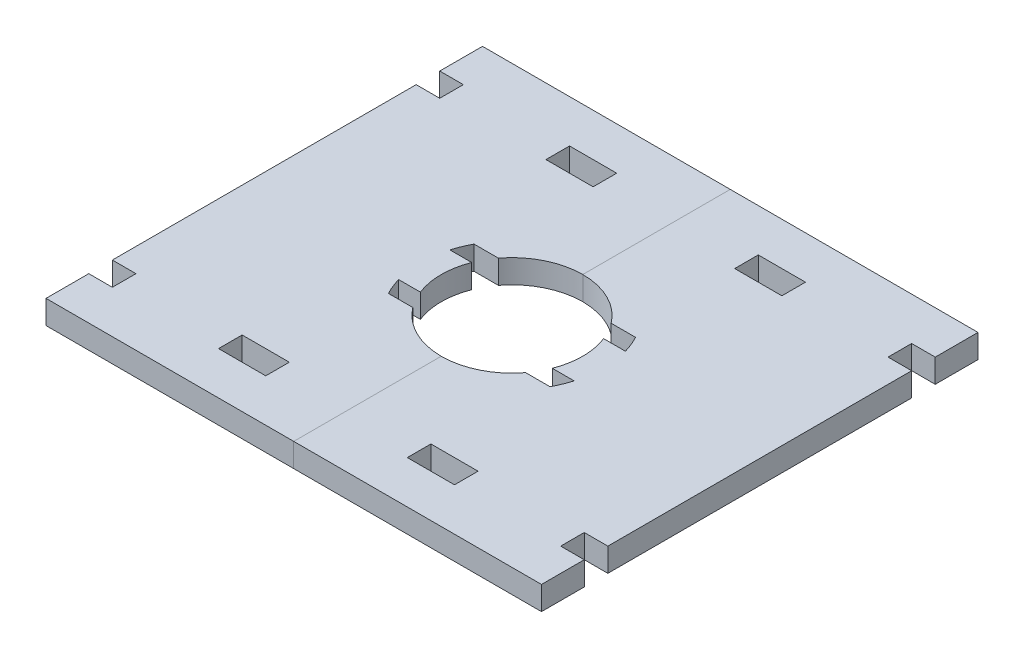
from build123d import *

# Parameters (mm, degrees)
SKETCH2_W               = 84
SKETCH2_H               = 74
BOSS_EXTRUDE1_DEPTH     = 4
CUT_EXTRUDE2_DEPTH      = 57.115951386
CUT_EXTRUDE2_DEPTH_BACK = 57.115951386
SKETCH4_W               = 8
SKETCH4_H               = 4
SKETCH4_W_2             = 4


with BuildPart() as part:
    # Sketch2 → Boss-Extrude1 (new body)
    with BuildSketch(Plane(origin=(0, 0, 0), x_dir=(1, 0, 0), z_dir=(0, 1, 0))):
        Rectangle(SKETCH2_W, SKETCH2_H)
        with BuildLine():
            ThreePointArc((11.183805256, 4.35), (12, 0), (11.183805256, -4.35))
            Line((11.183805256, -4.35), (14.877079687, -4.35))
            ThreePointArc((14.877079687, -4.35), (14.361878956, -5.829788405), (13.699908759, -7.25))
            Line((13.699908759, -7.25), (9.562295749, -7.25))
            ThreePointArc((9.562295749, -7.25), (0, -12), (-9.562295749, -7.25))
            Line((-9.562295749, -7.25), (-13.699908759, -7.25))
            ThreePointArc((-13.699908759, -7.25), (-14.361878956, -5.829788405), (-14.877079687, -4.35))
            Line((-14.877079687, -4.35), (-11.183805256, -4.35))
            ThreePointArc((-11.183805256, -4.35), (-12, 0), (-11.183805256, 4.35))
            Line((-11.183805256, 4.35), (-14.877079687, 4.35))
            ThreePointArc((-14.877079687, 4.35), (-14.361878956, 5.829788405), (-13.699908759, 7.25))
            Line((-13.699908759, 7.25), (-9.562295749, 7.25))
            ThreePointArc((-9.562295749, 7.25), (0, 12), (9.562295749, 7.25))
            Line((9.562295749, 7.25), (13.699908759, 7.25))
            ThreePointArc((13.699908759, 7.25), (14.361878956, 5.829788405), (14.877079687, 4.35))
            Line((14.877079687, 4.35), (11.183805256, 4.35))
        make_face(mode=Mode.SUBTRACT)
    extrude(amount=BOSS_EXTRUDE1_DEPTH)


with BuildPart() as body_2:
    # Split1: the piece on the far side of the plane
    add(part.part)
    split(bisect_by=Plane(origin=(0, 0, 0), x_dir=(0, 0, 1), z_dir=(1, 0, 0)), keep=Keep.BOTTOM)


with BuildPart() as part_1:
    add(part.part)

    # Split1
    split(bisect_by=Plane(origin=(0, 0, 0), x_dir=(0, 0, 1), z_dir=(1, 0, 0)), keep=Keep.TOP)


with BuildPart() as cut_extrude2_tool:
    # Sketch4 → Cut-Extrude2 (new, two sides: drawn at the far end of the back side and taken through both)
    with BuildSketch(Plane(origin=(0, 4, 0), x_dir=(1, 0, 0), z_dir=(0, 1, 0)).offset(-CUT_EXTRUDE2_DEPTH_BACK)):
        with Locations((-16, -27.75)):
            Rectangle(SKETCH4_W, SKETCH4_H)
        with Locations((-40, -27.75)):
            Rectangle(SKETCH4_W_2, SKETCH4_H)
        with Locations((40, -27.75)):
            Rectangle(SKETCH4_W_2, SKETCH4_H)
        with Locations((16, -27.75)):
            Rectangle(SKETCH4_W, SKETCH4_H)
        with Locations((16, 27.75)):
            Rectangle(SKETCH4_W, SKETCH4_H)
        with Locations((40, 27.75)):
            Rectangle(SKETCH4_W_2, SKETCH4_H)
        with Locations((-40, 27.75)):
            Rectangle(SKETCH4_W_2, SKETCH4_H)
        with Locations((-16, 27.75)):
            Rectangle(SKETCH4_W, SKETCH4_H)
    extrude(amount=CUT_EXTRUDE2_DEPTH + CUT_EXTRUDE2_DEPTH_BACK)


with BuildPart() as part_2:
    add(part_1.part)

    # Cut-Extrude2: cut by cut_extrude2_tool
    add(cut_extrude2_tool.part, mode=Mode.SUBTRACT)


with BuildPart() as body_2_1:
    add(body_2.part)

    # Cut-Extrude2: cut by cut_extrude2_tool
    add(cut_extrude2_tool.part, mode=Mode.SUBTRACT)


solid = Compound([part_2.part, body_2_1.part])
